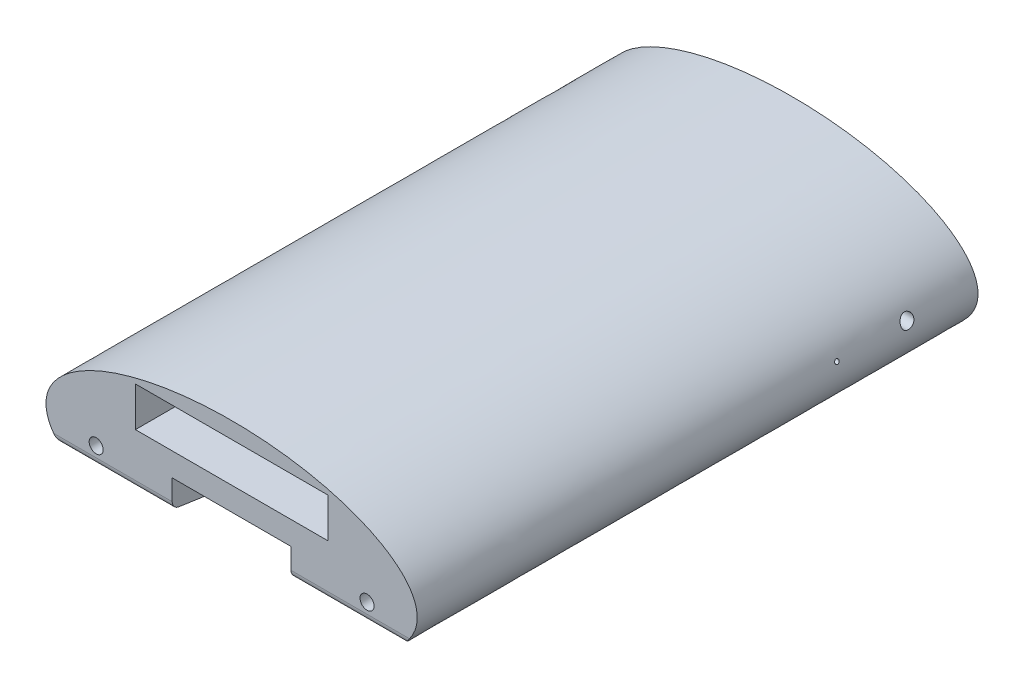
from build123d import *
from OCP.BRepAlgoAPI import BRepAlgoAPI_Cut
from OCP.TopTools import TopTools_ListOfShape

# Parameters (mm, degrees)
SKETCH1_RX              = 238.176778745998
SKETCH1_RY              = 100
SKETCH1_R               = 9.000000000000009
SKETCH1_W               = 152.4
SKETCH1_H               = 77
BOSS_EXTRUDE1_DEPTH     = 719.5500000000001
CUT_EXTRUDE1_DEPTH      = 771.8388550363948
CUT_EXTRUDE1_DEPTH_BACK = 771.8388550363948
FILLET1_R               = 9.999999999999996
BOSS_EXTRUDE2_REACH     = 780.772
SKETCH4_W               = 152.4
SKETCH4_H               = 277.7592603894774
CUT_EXTRUDE2_DEPTH      = 771.8388551788538
CUT_EXTRUDE2_DEPTH_BACK = 771.8388551788538
SKETCH5_R               = 2.7500000000000084
SKETCH5_R_2             = 8.50000000000001


with BuildPart() as part:
    # Sketch1 → Boss-Extrude1 (new body)
    with BuildSketch(Plane.XY):
        with Locations(Location((0, 40.399999999999984), (0, 0, 6.84e-15))):
            Ellipse(SKETCH1_RX, SKETCH1_RY)
        with Locations((173.785, 25.400000000000006)):
            Circle(SKETCH1_R, mode=Mode.SUBTRACT)
        with Locations((-173.785, 25.400000000000006)):
            Circle(SKETCH1_R, mode=Mode.SUBTRACT)
        Polygon((-123.39999999999999, 119.29999999999997), (123.39999999999999, 119.3), (123.4, 68.5), (-123.4, 68.49999999999997), align=None, mode=Mode.SUBTRACT)
        Rectangle(SKETCH1_W, SKETCH1_H, mode=Mode.SUBTRACT)
    extrude(amount=BOSS_EXTRUDE1_DEPTH)

    # Sketch3 → Cut-Extrude1 (cut, two sides: drawn at the far end of the back side and taken through both)
    with BuildSketch(Plane(origin=(0, 0, 0), x_dir=(0, 0, -1), z_dir=(1, 0, 0)).offset(-CUT_EXTRUDE1_DEPTH_BACK)):
        Polygon((1280.4819340937215, -287.25956976454023), (-201.17484480506153, -72.00000000000001), (-731.1748448050615, 4.999999999999994), (-2212.831623703845, 220.2595697645402), (-2643.350763232925, -2743.053988033026), (849.9627945646412, -3250.5731275621065), align=None)
    extrude(amount=CUT_EXTRUDE1_DEPTH + CUT_EXTRUDE1_DEPTH_BACK, mode=Mode.SUBTRACT)

    # Fillet1
    fillet1_edges = [part.edges().sort_by_distance(p)[0] for p in [
        (148.69467604524613, 3.311107452849548, 719.5500000000004),
        (-148.69467604524613, 3.311107452849548, 719.5500000000004),
    ]]
    fillet(fillet1_edges, radius=FILLET1_R)

    # Sketch4 → Boss-Extrude2 (add, up to next)
    with BuildSketch(Plane(origin=(0, -38.5, 0), x_dir=(1, 0, 0), z_dir=(0, 1, 0)), mode=Mode.PRIVATE) as boss_extrude2_sk1:
        with Locations((0, -292.8796301947387)):
            Rectangle(SKETCH4_W, SKETCH4_H)
    boss_extrude2_tool1 = extrude(boss_extrude2_sk1.sketch, amount=BOSS_EXTRUDE2_REACH, mode=Mode.PRIVATE) - part.part
    add(boss_extrude2_tool1.solids().sort_by_distance((0, -38.5, 292.87963))[0])


with BuildPart() as cut_extrude2_tool:
    # Sketch5 → Cut-Extrude2 (new, two sides: drawn at the far end of the back side and taken through both)
    with BuildSketch(Plane(origin=(0, 0, 0), x_dir=(0, 0, -1), z_dir=(1, 0, 0)).offset(-CUT_EXTRUDE2_DEPTH_BACK)):
        with Locations((-179.00000000000003, 53.5)):
            Circle(SKETCH5_R)
        with Locations((-89.00000000000003, 53.5)):
            Circle(SKETCH5_R_2)
    extrude(amount=CUT_EXTRUDE2_DEPTH + CUT_EXTRUDE2_DEPTH_BACK)


with BuildPart() as part_1:
    add(part.part)

    # Cut-Extrude2: cut by cut_extrude2_tool, with a tolerance
    cut_extrude2_stock = TopTools_ListOfShape()
    cut_extrude2_stock.Append(part_1.part.wrapped)
    cut_extrude2_tools = TopTools_ListOfShape()
    cut_extrude2_tools.Append(cut_extrude2_tool.part.wrapped)
    cut_extrude2_cut = BRepAlgoAPI_Cut()
    cut_extrude2_cut.SetArguments(cut_extrude2_stock)
    cut_extrude2_cut.SetTools(cut_extrude2_tools)
    cut_extrude2_cut.SetFuzzyValue(0.00001)
    cut_extrude2_cut.Build()
    add(Compound.cast(cut_extrude2_cut.Shape()).solids(), mode=Mode.REPLACE)


solid = part_1.part
